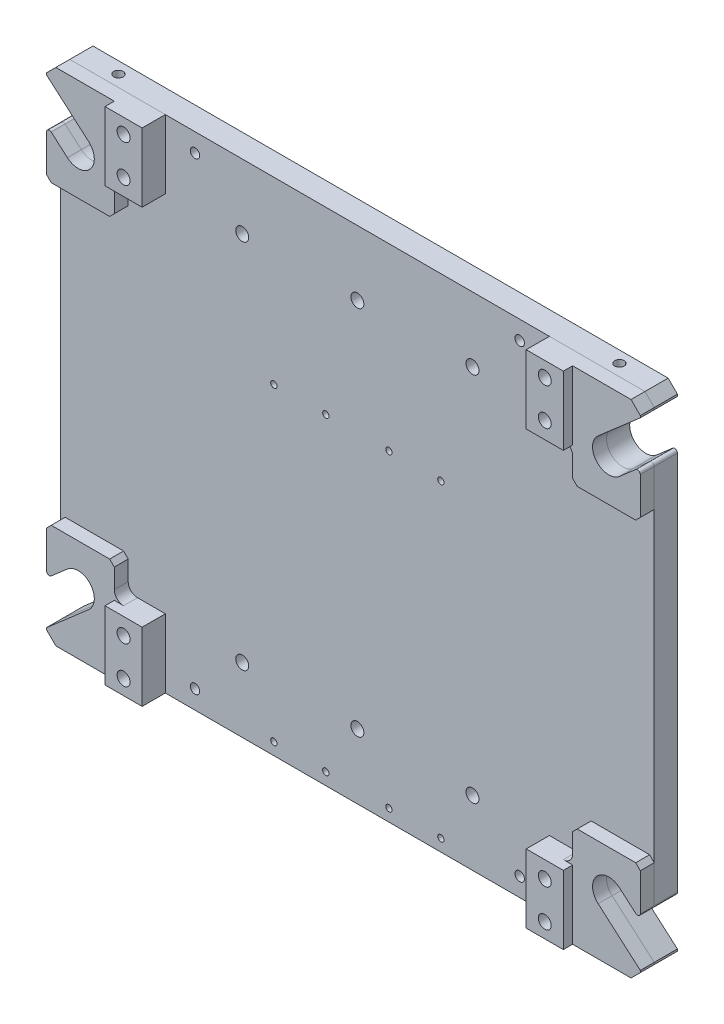
from build123d import *

# Parameters (mm, degrees)
ESBO_O1_W                                    = 300
ESBO_O1_H                                    = 600
RESSALTO_EXTRUS_O1_DEPTH                     = 25
ESBO_O2_W                                    = 25
ESBO_O2_H                                    = 600
RESSALTO_EXTRUS_O2_DEPTH                     = 170
CHANFRO1_SIZE                                = 10
MOVER_START                                  = -240
MOVER_FACE1_DEPTH                            = 25
MOVER_FACE2_DEPTH                            = 25
MOVER_FACE4_DEPTH                            = 25
MOVER_FACE5_DEPTH                            = 25
CORTE_EXTRUS_O1_DEPTH                        = 420.434142626
ESBO_O4_W                                    = 40
ESBO_O4_H                                    = 74
NNN_DEPTH                                    = 15
NNN_2_DEPTH                                  = 15
NNN_3_DEPTH                                  = 15
NNN_4_DEPTH                                  = 15
NNN_5_DEPTH                                  = 15
NNN_6_DEPTH                                  = 15
NNN_7_DEPTH                                  = 15
NNN_8_DEPTH                                  = 15
MOVER_FACE3_BY                               = 10
MOVER_FACE3_2_BY                             = 10
MOVER_FACE3_3_BY                             = 10
MOVER_FACE3_4_BY                             = 10
RESSALTO_EXTRUS_O9_DEPTH                     = 15
CORTE_EXTRUS_O3_DEPTH                        = 422.663372846
CORTE_EXTRUS_O4_DEPTH                        = 421.594816896
MOVER_START_2                                = -215
MOVER_FACE6_DEPTH                            = 15
MOVER_FACE7_DEPTH                            = 15
MOVER_FACE8_DEPTH                            = 15
MOVER_FACE9_DEPTH                            = 15
FURO_ROSCADO_DE_M81_AT_2_COUNT               = 2
FURO_ROSCADO_DE_M81_AT_2_PITCH               = 56
FURO_ROSCADO_DE_M81_AT_3_COUNT               = 2
FURO_ROSCADO_DE_M81_AT_3_PITCH               = 124
FURO_ROSCADO_DE_M81_AT_4_COUNT               = 2
FURO_ROSCADO_DE_M81_AT_4_PITCH               = 180
FURO_ROSCADO_DE_M81_AT_5_COUNT               = 2
FURO_ROSCADO_DE_M81_AT_5_PITCH               = 333.5
FURO_ROSCADO_DE_M81_AT_6_COUNT               = 2
FURO_ROSCADO_DE_M81_AT_6_PITCH               = 338.168966642
FURO_ROSCADO_DE_M81_AT_7_COUNT               = 2
FURO_ROSCADO_DE_M81_AT_7_PITCH               = 355.8064783
FURO_ROSCADO_DE_M81_AT_8_COUNT               = 2
FURO_ROSCADO_DE_M81_AT_8_PITCH               = 378.975263045
REBAIXO_PARA_PARAFUSO_ALLEN_SEXTAVAD_2_COUNT = 2
REBAIXO_PARA_PARAFUSO_ALLEN_SEXTAVAD_2_PITCH = 400
REBAIXO_PARA_PARAFUSO_ALLEN_SEXTAVAD_3_COUNT = 2
REBAIXO_PARA_PARAFUSO_ALLEN_SEXTAVAD_3_PITCH = 418.808798857
REBAIXO_PARA_PARAFUSO_ALLEN_SEXTAVAD_4_COUNT = 2
REBAIXO_PARA_PARAFUSO_ALLEN_SEXTAVAD_4_PITCH = 470.747533185
REBAIXO_PARA_PARAFUSO_ALLEN_SEXTAVAD_5_COUNT = 2
REBAIXO_PARA_PARAFUSO_ALLEN_SEXTAVAD_5_PITCH = 248.2
REBAIXO_PARA_PARAFUSO_ALLEN_SEXTAVAD_6_COUNT = 2
REBAIXO_PARA_PARAFUSO_ALLEN_SEXTAVAD_6_PITCH = 124.1
FURO_ROSCADO_DE_M161_AT_2_COUNT              = 2
FURO_ROSCADO_DE_M161_AT_2_PITCH              = 40
FURO_ROSCADO_DE_M161_AT_3_COUNT              = 2
FURO_ROSCADO_DE_M161_AT_3_PITCH              = 454
FURO_ROSCADO_DE_M161_AT_4_COUNT              = 2
FURO_ROSCADO_DE_M161_AT_4_PITCH              = 455.75870809
FURO_ROSCADO_DE_M161_AT_5_COUNT              = 2
FURO_ROSCADO_DE_M161_AT_5_PITCH              = 652.027606778
FURO_ROSCADO_DE_M161_AT_6_COUNT              = 2
FURO_ROSCADO_DE_M161_AT_6_PITCH              = 681.307566375
FURO_ROSCADO_DE_M161_AT_7_COUNT              = 2
FURO_ROSCADO_DE_M161_AT_7_PITCH              = 508
FURO_ROSCADO_DE_M161_AT_8_COUNT              = 2
FURO_ROSCADO_DE_M161_AT_8_PITCH              = 468
FILETE1_R                                    = 3
FILETE2_R                                    = 3
FILETE3_R                                    = 3
FILETE4_R                                    = 3
FILETE5_R                                    = 3
FURO_ROSCADO_DE_M121_AT_2_COUNT              = 2
FURO_ROSCADO_DE_M121_AT_2_PITCH              = 540
FURO_ROSCADO_DE_M1211_AT_2_COUNT             = 2
FURO_ROSCADO_DE_M1211_AT_2_PITCH             = 500
FURO_ROSCADO_DE_M1211_AT_3_COUNT             = 2
FURO_ROSCADO_DE_M1211_AT_3_PITCH             = 350
FURO_ROSCADO_DE_M1211_AT_4_COUNT             = 2
FURO_ROSCADO_DE_M1211_AT_4_PITCH             = 610.327780787
FILETE9_R                                    = 10
FILETE8_R                                    = 10
FILETE7_R                                    = 10
FILETE6_R                                    = 10
EXCLUIR_START                                = -240
EXCLUIR_FACE1_DEPTH                          = 25
CORTE_EXTRUS_O5_DEPTH                        = 421.594816896
RESSALTO_EXTRUS_O11_DEPTH                    = 15


# Read off the part's stored shape, not the designer's step: Mover face1, Mover face2, Mover face4, Mover face5, Mover face6, Mover face7, Mover face8, Mover face9, Excluir face1
with BuildPart() as part:
    # Esboço1 → Ressalto-extrusão1 (new body)
    with BuildSketch(Plane.XY.offset(-240)):
        Rectangle(ESBO_O1_W, ESBO_O1_H)
    extrude(amount=RESSALTO_EXTRUS_O1_DEPTH)

    # Esboço2 → Ressalto-extrusão2 (add)
    with BuildSketch(Plane(origin=(150, 0, 0), x_dir=(0, 0, -1), z_dir=(1, 0, 0))):
        with Locations((227.5, 0)):
            Rectangle(ESBO_O2_W, ESBO_O2_H)
    ressalto_extrus_o2 = extrude(amount=RESSALTO_EXTRUS_O2_DEPTH)

    # Espelhar1: Ressalto-extrusão2 across plane
    add(ressalto_extrus_o2.mirror(Plane(origin=(0, 0, 0), x_dir=(0, 0, 1), z_dir=(1, 0, 0))))

    # Chanfro1
    chanfro1_edges = [part.edges().sort_by_distance(p)[0] for p in [
        (320, 300, -227.5),
        (320, -300, -227.5),
        (-320, 300, -227.5),
        (-320, -300, -227.5),
    ]]
    chamfer(chanfro1_edges, length=CHANFRO1_SIZE)

    # Mover face1 outline → Mover face1 (add)
    with BuildSketch(Plane.XY.offset(MOVER_START)):
        Polygon((-310, -330), (310, -330), (320, -320), (320, -290), (310, -300), (-310, -300), (-320, -290), (-320, -320), align=None)
    extrude(amount=MOVER_FACE1_DEPTH)

    # Mover face2 outline → Mover face2 (add)
    with BuildSketch(Plane.XY.offset(MOVER_START)):
        Polygon((310, 330), (-310, 330), (-320, 320), (-320, 290), (-310, 300), (310, 300), (320, 290), (320, 320), align=None)
    extrude(amount=MOVER_FACE2_DEPTH)

    # Mover face4 outline → Mover face4 (cut)
    with BuildSketch(Plane.XY.offset(MOVER_START)):
        Polygon((320, -260), (310, -270), (-310, -270), (-320, -260), (-320, -320), (-310, -330), (310, -330), (320, -320), align=None)
    extrude(amount=MOVER_FACE4_DEPTH, mode=Mode.SUBTRACT)

    # Mover face5 outline → Mover face5 (cut)
    with BuildSketch(Plane.XY.offset(MOVER_START)):
        Polygon((-320, 260), (-310, 270), (310, 270), (320, 260), (320, 320), (310, 330), (-310, 330), (-320, 320), align=None)
    extrude(amount=MOVER_FACE5_DEPTH, mode=Mode.SUBTRACT)

    # Esboço3 → Corte-extrusão1 (cut, through all)
    with BuildSketch(Plane.XY.offset(-215)):
        with BuildLine():
            Line((-355, -134.9), (-285, -134.9))
            ThreePointArc((-285, -134.9), (-267.5, -152.4), (-285, -169.9))
            Line((-285, -169.9), (-355, -169.9))
            ThreePointArc((-355, -169.9), (-372.5, -152.4), (-355, -134.9))
        make_face()
        with BuildLine():
            Line((-355, 134.9), (-285, 134.9))
            ThreePointArc((-285, 134.9), (-267.5, 152.4), (-285, 169.9))
            Line((-285, 169.9), (-355, 169.9))
            ThreePointArc((-355, 169.9), (-372.5, 152.4), (-355, 134.9))
        make_face()
        with BuildLine():
            Line((355, 134.9), (285, 134.9))
            ThreePointArc((285, 134.9), (267.5, 152.4), (285, 169.9))
            Line((285, 169.9), (355, 169.9))
            ThreePointArc((355, 169.9), (372.5, 152.4), (355, 134.9))
        make_face()
        with BuildLine():
            Line((355, -134.9), (285, -134.9))
            ThreePointArc((285, -134.9), (267.5, -152.4), (285, -169.9))
            Line((285, -169.9), (355, -169.9))
            ThreePointArc((355, -169.9), (372.5, -152.4), (355, -134.9))
        make_face()
    extrude(amount=-CORTE_EXTRUS_O1_DEPTH, mode=Mode.SUBTRACT)


with BuildPart() as body_2:
    # Esboço4 → nnn (new body)
    with BuildSketch(Plane.XY.offset(-215)):
        with Locations((227, -233)):
            Rectangle(ESBO_O4_W, ESBO_O4_H)
    extrude(amount=NNN_DEPTH)

    # Mover face3 3: a face moved outward by 10.0
    extrude(body_2.faces().sort_by_distance((227, -233, -200))[0], amount=MOVER_FACE3_3_BY, dir=(0, 0, 1))


with BuildPart() as body_3:
    # Esboço4 → nnn 2 (new body)
    with BuildSketch(Plane.XY.offset(-215)):
        with Locations((227, 233)):
            Rectangle(ESBO_O4_W, ESBO_O4_H)
    extrude(amount=NNN_2_DEPTH)

    # Mover face3: a face moved outward by 10.0
    extrude(body_3.faces().sort_by_distance((227, 233, -200))[0], amount=MOVER_FACE3_BY, dir=(0, 0, 1))


with BuildPart() as body_4:
    # Esboço4 → nnn 3 (new body)
    with BuildSketch(Plane.XY.offset(-215)):
        with Locations((-227, 233)):
            Rectangle(ESBO_O4_W, ESBO_O4_H)
    extrude(amount=NNN_3_DEPTH)

    # Mover face3 2: a face moved outward by 10.0
    extrude(body_4.faces().sort_by_distance((-227, 233, -200))[0], amount=MOVER_FACE3_2_BY, dir=(0, 0, 1))


with BuildPart() as body_5:
    # Esboço4 → nnn 4 (new body)
    with BuildSketch(Plane.XY.offset(-215)):
        with Locations((-227, -233)):
            Rectangle(ESBO_O4_W, ESBO_O4_H)
    extrude(amount=NNN_4_DEPTH)

    # Mover face3 4: a face moved outward by 10.0
    extrude(body_5.faces().sort_by_distance((-227, -233, -200))[0], amount=MOVER_FACE3_4_BY, dir=(0, 0, 1))


with BuildPart() as body_6:
    # Esboço4 → nnn 5 (new body)
    with BuildSketch(Plane.XY.offset(-215)):
        with BuildLine():
            Line((320, 169.9), (320, 184.9))
            Line((320, 184.9), (315, 189.9))
            Line((315, 189.9), (257, 189.9))
            Line((257, 189.9), (247, 179.9))
            Line((247, 179.9), (247, 124.9))
            Line((247, 124.9), (257, 114.9))
            Line((257, 114.9), (315, 114.9))
            Line((315, 114.9), (320, 119.9))
            Line((320, 119.9), (320, 134.9))
            Line((320, 134.9), (285, 134.9))
            ThreePointArc((285, 134.9), (267.5, 152.4), (285, 169.9))
            Line((285, 169.9), (320, 169.9))
        make_face()
    extrude(amount=NNN_5_DEPTH)


with BuildPart() as body_7:
    # Esboço4 → nnn 6 (new body)
    with BuildSketch(Plane.XY.offset(-215)):
        with BuildLine():
            Line((-320, -169.9), (-320, -184.9))
            Line((-320, -184.9), (-315, -189.9))
            Line((-315, -189.9), (-257, -189.9))
            Line((-257, -189.9), (-247, -179.9))
            Line((-247, -179.9), (-247, -124.9))
            Line((-247, -124.9), (-257, -114.9))
            Line((-257, -114.9), (-315, -114.9))
            Line((-315, -114.9), (-320, -119.9))
            Line((-320, -119.9), (-320, -134.9))
            Line((-320, -134.9), (-285, -134.9))
            ThreePointArc((-285, -134.9), (-267.5, -152.4), (-285, -169.9))
            Line((-285, -169.9), (-320, -169.9))
        make_face()
    extrude(amount=NNN_6_DEPTH)


    add(body_5.part)  # Ressalto-extrusão9 merges body 5

    add(body_4.part)  # Ressalto-extrusão9 merges body 4


with BuildPart() as body_8:
    # Esboço4 → nnn 7 (new body)
    with BuildSketch(Plane.XY.offset(-215)):
        with BuildLine():
            Line((320, -134.9), (320, -119.9))
            Line((320, -119.9), (315, -114.9))
            Line((315, -114.9), (257, -114.9))
            Line((257, -114.9), (247, -124.9))
            Line((247, -124.9), (247, -179.9))
            Line((247, -179.9), (257, -189.9))
            Line((257, -189.9), (315, -189.9))
            Line((315, -189.9), (320, -184.9))
            Line((320, -184.9), (320, -169.9))
            Line((320, -169.9), (285, -169.9))
            ThreePointArc((285, -169.9), (267.5, -152.4), (285, -134.9))
            Line((285, -134.9), (320, -134.9))
        make_face()
    extrude(amount=NNN_7_DEPTH)


with BuildPart() as body_9:
    # Esboço4 → nnn 8 (new body)
    with BuildSketch(Plane.XY.offset(-215)):
        with BuildLine():
            Line((-320, 134.9), (-320, 119.9))
            Line((-320, 119.9), (-315, 114.9))
            Line((-315, 114.9), (-257, 114.9))
            Line((-257, 114.9), (-247, 124.9))
            Line((-247, 124.9), (-247, 179.9))
            Line((-247, 179.9), (-257, 189.9))
            Line((-257, 189.9), (-315, 189.9))
            Line((-315, 189.9), (-320, 184.9))
            Line((-320, 184.9), (-320, 169.9))
            Line((-320, 169.9), (-285, 169.9))
            ThreePointArc((-285, 169.9), (-267.5, 152.4), (-285, 134.9))
            Line((-285, 134.9), (-320, 134.9))
        make_face()
    extrude(amount=NNN_8_DEPTH)


with BuildPart() as body_7_1:
    add(body_7.part)

    add(body_9.part)  # Ressalto-extrusão9 merges body 9

    add(body_3.part)  # Ressalto-extrusão9 merges body 3

    add(body_6.part)  # Ressalto-extrusão9 merges body 6

    add(body_8.part)  # Ressalto-extrusão9 merges body 8

    add(body_2.part)  # Ressalto-extrusão9 merges body 2
    # Esboço48 → Ressalto-extrusão9 (add)
    with BuildSketch(Plane.XY.offset(-200)):
        Polygon((-320, 260), (-320, 177.4), (-247, 177.4), (-247, 270), (-310, 270), align=None)
        Polygon((320, 260), (310, 270), (247, 270), (247, 177.4), (320, 177.4), align=None)
        Polygon((310, -270), (320, -260), (320, -177.4), (247, -177.4), (247, -270), align=None)
        Polygon((-320, -260), (-310, -270), (-247, -270), (-247, -177.4), (-320, -177.4), align=None)
    extrude(amount=-RESSALTO_EXTRUS_O9_DEPTH)


with BuildPart() as corte_extrus_o3_tool:
    # Esboço51 → Corte-extrusão3 (new, through all)
    with BuildSketch(Plane.XY.offset(-190)):
        Polygon((-320, -169.9), (-320, -174.9), (-315, -169.9), align=None)
        Polygon((-320, -129.9), (-315, -134.9), (-320, -134.9), align=None)
        Polygon((-320, 174.9), (-315, 169.9), (-320, 169.9), align=None)
        Polygon((-320, 134.9), (-320, 129.9), (-315, 134.9), align=None)
        Polygon((315, -134.9), (320, -134.9), (320, -129.9), align=None)
        Polygon((315, -169.9), (320, -169.9), (320, -174.9), align=None)
        Polygon((320, 129.9), (315, 134.9), (320, 134.9), align=None)
        Polygon((315, 169.9), (320, 169.9), (320, 174.9), align=None)
    extrude(amount=-CORTE_EXTRUS_O3_DEPTH)


with BuildPart() as part_1:
    add(part.part)

    # Corte-extrusão3: cut by corte_extrus_o3_tool
    add(corte_extrus_o3_tool.part, mode=Mode.SUBTRACT)


with BuildPart() as body_7_2:
    add(body_7_1.part)

    # Corte-extrusão3: cut by corte_extrus_o3_tool
    add(corte_extrus_o3_tool.part, mode=Mode.SUBTRACT)


with BuildPart() as corte_extrus_o4_tool:
    # Esboço53 → Corte-extrusão4 (new, through all)
    with BuildSketch(Plane.XY.offset(-200)):
        with BuildLine():
            Line((-274.557035883, -218.39218056), (-342.480898103, -277.437493169))
            ThreePointArc((-342.480898103, -277.437493169), (-367.169348764, -275.711108522), (-365.442964117, -251.022657861))
            Line((-365.442964117, -251.022657861), (-297.519101897, -191.977345252))
            ThreePointArc((-297.519101897, -191.977345252), (-272.830651236, -193.703729898), (-274.557035883, -218.39218056))
        make_face()
        with BuildLine():
            Line((-274.557035883, 218.39218056), (-342.480898103, 277.437493169))
            ThreePointArc((-342.480898103, 277.437493169), (-367.169348764, 275.711108522), (-365.442964117, 251.022657861))
            Line((-365.442964117, 251.022657861), (-297.519101897, 191.977345252))
            ThreePointArc((-297.519101897, 191.977345252), (-272.830651236, 193.703729898), (-274.557035883, 218.39218056))
        make_face()
        with BuildLine():
            Line((274.557035883, 218.39218056), (342.480898103, 277.437493169))
            ThreePointArc((342.480898103, 277.437493169), (367.169348764, 275.711108522), (365.442964117, 251.022657861))
            Line((365.442964117, 251.022657861), (297.519101897, 191.977345252))
            ThreePointArc((297.519101897, 191.977345252), (272.830651236, 193.703729898), (274.557035883, 218.39218056))
        make_face()
        with BuildLine():
            Line((274.557035883, -218.39218056), (342.480898103, -277.437493169))
            ThreePointArc((342.480898103, -277.437493169), (367.169348764, -275.711108522), (365.442964117, -251.022657861))
            Line((365.442964117, -251.022657861), (297.519101897, -191.977345252))
            ThreePointArc((297.519101897, -191.977345252), (272.830651236, -193.703729898), (274.557035883, -218.39218056))
        make_face()
    extrude(amount=-CORTE_EXTRUS_O4_DEPTH)


with BuildPart() as part_2:
    add(part_1.part)

    # Corte-extrusão4: cut by corte_extrus_o4_tool
    add(corte_extrus_o4_tool.part, mode=Mode.SUBTRACT)

    # Esboço41 → Furo roscado de M81 (revolve, cut)
    with BuildSketch(Plane(origin=(-90, 76.5, -215), x_dir=(0, -1, 0), z_dir=(1, 0, 0))):
        Polygon((0, 0), (0, 20.042926105), (3.4, 18), (3.4, 0), align=None)
    furo_roscado_de_m81 = revolve(axis=Axis((-90, 76.5, -208.65), (0, 0, -1)), mode=Mode.SUBTRACT)

    # Furo roscado de M81 at 2: Furo roscado de M81 ×2
    with Locations(*[(i * FURO_ROSCADO_DE_M81_AT_2_PITCH, 0, 0) for i in range(1, FURO_ROSCADO_DE_M81_AT_2_COUNT)]):
        add(furo_roscado_de_m81, mode=Mode.SUBTRACT)

    # Furo roscado de M81 at 3: Furo roscado de M81 ×2
    with Locations(*[(i * FURO_ROSCADO_DE_M81_AT_3_PITCH, 0, 0) for i in range(1, FURO_ROSCADO_DE_M81_AT_3_COUNT)]):
        add(furo_roscado_de_m81, mode=Mode.SUBTRACT)

    # Furo roscado de M81 at 4: Furo roscado de M81 ×2
    with Locations(*[(i * FURO_ROSCADO_DE_M81_AT_4_PITCH, 0, 0) for i in range(1, FURO_ROSCADO_DE_M81_AT_4_COUNT)]):
        add(furo_roscado_de_m81, mode=Mode.SUBTRACT)

    # Furo roscado de M81 at 5: Furo roscado de M81 ×2
    with Locations(*[(0, -i * FURO_ROSCADO_DE_M81_AT_5_PITCH, 0) for i in range(1, FURO_ROSCADO_DE_M81_AT_5_COUNT)]):
        add(furo_roscado_de_m81, mode=Mode.SUBTRACT)

    # Furo roscado de M81 at 6: Furo roscado de M81 ×2
    with Locations(*[Vector(0.16559769087035991, -0.9861933911654472, 0) * (i * FURO_ROSCADO_DE_M81_AT_6_PITCH) for i in range(1, FURO_ROSCADO_DE_M81_AT_6_COUNT)]):
        add(furo_roscado_de_m81, mode=Mode.SUBTRACT)

    # Furo roscado de M81 at 7: Furo roscado de M81 ×2
    with Locations(*[Vector(0.3485040536433699, -0.937307273306966, 0) * (i * FURO_ROSCADO_DE_M81_AT_7_PITCH) for i in range(1, FURO_ROSCADO_DE_M81_AT_7_COUNT)]):
        add(furo_roscado_de_m81, mode=Mode.SUBTRACT)

    # Furo roscado de M81 at 8: Furo roscado de M81 ×2
    with Locations(*[Vector(0.4749650374374, -0.8800046665854047, 0) * (i * FURO_ROSCADO_DE_M81_AT_8_PITCH) for i in range(1, FURO_ROSCADO_DE_M81_AT_8_COUNT)]):
        add(furo_roscado_de_m81, mode=Mode.SUBTRACT)

    # Esboço8 → Rebaixo para parafuso Allen sextavado de M121 (revolve, cut)
    with BuildSketch(Plane(origin=(-124.1, -200, -240), x_dir=(0, 1, 0), z_dir=(1, 0, 0))):
        Polygon((0, 0), (0, 25), (7, 25), (7, 13), (10, 13), (10, 0), align=None)
    rebaixo_para_parafuso_allen_sextavado_de = revolve(axis=Axis((-124.1, -200, -246.35), (0, 0, 1)), mode=Mode.SUBTRACT)

    # Rebaixo para parafuso Allen sextavad 2: Rebaixo para parafuso Allen sextavado de M121 ×2
    with Locations(*[(0, i * REBAIXO_PARA_PARAFUSO_ALLEN_SEXTAVAD_2_PITCH, 0) for i in range(1, REBAIXO_PARA_PARAFUSO_ALLEN_SEXTAVAD_2_COUNT)]):
        add(rebaixo_para_parafuso_allen_sextavado_de, mode=Mode.SUBTRACT)

    # Rebaixo para parafuso Allen sextavad 3: Rebaixo para parafuso Allen sextavado de M121 ×2
    with Locations(*[Vector(0.2963166016060431, 0.9550897714940966, 0) * (i * REBAIXO_PARA_PARAFUSO_ALLEN_SEXTAVAD_3_PITCH) for i in range(1, REBAIXO_PARA_PARAFUSO_ALLEN_SEXTAVAD_3_COUNT)]):
        add(rebaixo_para_parafuso_allen_sextavado_de, mode=Mode.SUBTRACT)

    # Rebaixo para parafuso Allen sextavad 4: Rebaixo para parafuso Allen sextavado de M121 ×2
    with Locations(*[Vector(0.5272465228242129, 0.8497123655507061, 0) * (i * REBAIXO_PARA_PARAFUSO_ALLEN_SEXTAVAD_4_PITCH) for i in range(1, REBAIXO_PARA_PARAFUSO_ALLEN_SEXTAVAD_4_COUNT)]):
        add(rebaixo_para_parafuso_allen_sextavado_de, mode=Mode.SUBTRACT)

    # Rebaixo para parafuso Allen sextavad 5: Rebaixo para parafuso Allen sextavado de M121 ×2
    with Locations(*[(i * REBAIXO_PARA_PARAFUSO_ALLEN_SEXTAVAD_5_PITCH, 0, 0) for i in range(1, REBAIXO_PARA_PARAFUSO_ALLEN_SEXTAVAD_5_COUNT)]):
        add(rebaixo_para_parafuso_allen_sextavado_de, mode=Mode.SUBTRACT)

    # Rebaixo para parafuso Allen sextavad 6: Rebaixo para parafuso Allen sextavado de M121 ×2
    with Locations(*[(i * REBAIXO_PARA_PARAFUSO_ALLEN_SEXTAVAD_6_PITCH, 0, 0) for i in range(1, REBAIXO_PARA_PARAFUSO_ALLEN_SEXTAVAD_6_COUNT)]):
        add(rebaixo_para_parafuso_allen_sextavado_de, mode=Mode.SUBTRACT)


with BuildPart() as body_7_3:
    add(body_7_2.part)

    # Corte-extrusão4: cut by corte_extrus_o4_tool
    add(corte_extrus_o4_tool.part, mode=Mode.SUBTRACT)

    # Mover face6 outline → Mover face6 (add)
    with BuildSketch(Plane.XY.offset(MOVER_START_2)):
        Polygon((-320, -109.9), (-320, -119.9), (-315, -114.9), (-257, -114.9), (-247, -124.9), (-247, -114.9), (-257, -104.9), (-315, -104.9), align=None)
    extrude(amount=MOVER_FACE6_DEPTH)

    # Mover face7 outline → Mover face7 (add)
    with BuildSketch(Plane.XY.offset(MOVER_START_2)):
        Polygon((-320, 119.9), (-320, 109.9), (-315, 104.9), (-257, 104.9), (-247, 114.9), (-247, 124.9), (-257, 114.9), (-315, 114.9), align=None)
    extrude(amount=MOVER_FACE7_DEPTH)

    # Mover face8 outline → Mover face8 (add)
    with BuildSketch(Plane.XY.offset(MOVER_START_2)):
        Polygon((320, -119.9), (320, -109.9), (315, -104.9), (257, -104.9), (247, -114.9), (247, -124.9), (257, -114.9), (315, -114.9), align=None)
    extrude(amount=MOVER_FACE8_DEPTH)

    # Mover face9 outline → Mover face9 (add)
    with BuildSketch(Plane.XY.offset(MOVER_START_2)):
        Polygon((320, 109.9), (320, 119.9), (315, 114.9), (257, 114.9), (247, 124.9), (247, 114.9), (257, 104.9), (315, 104.9), align=None)
    extrude(amount=MOVER_FACE9_DEPTH)


with BuildPart() as furo_roscado_de_m161_tool:
    # Esboço42 → Furo roscado de M161 (revolve)
    with BuildSketch(Plane(origin=(227, -254, -190), x_dir=(0, -1, 0), z_dir=(1, 0, 0))):
        Polygon((0, 0), (0, 34.206024333), (7, 30), (7, 0), align=None)
    furo_roscado_de_m161 = revolve(axis=Axis((227, -254, -183.65), (0, 0, -1)))


with BuildPart() as part_3:
    add(part_2.part)

    # Furo roscado de M161: cut by furo_roscado_de_m161_tool
    add(furo_roscado_de_m161_tool.part, mode=Mode.SUBTRACT)


with BuildPart() as body_7_4:
    add(body_7_3.part)

    # Furo roscado de M161: cut by furo_roscado_de_m161_tool
    add(furo_roscado_de_m161_tool.part, mode=Mode.SUBTRACT)


with BuildPart() as furo_roscado_de_m161_at_2_tool:
    # Furo roscado de M161 at 2: Furo roscado de M161 ×2
    with Locations(*[(0, i * FURO_ROSCADO_DE_M161_AT_2_PITCH, 0) for i in range(1, FURO_ROSCADO_DE_M161_AT_2_COUNT)]):
        add(furo_roscado_de_m161)


with BuildPart() as part_4:
    add(part_3.part)

    # Furo roscado de M161 at 2: cut by furo_roscado_de_m161_at_2_tool
    add(furo_roscado_de_m161_at_2_tool.part, mode=Mode.SUBTRACT)


with BuildPart() as body_7_5:
    add(body_7_4.part)

    # Furo roscado de M161 at 2: cut by furo_roscado_de_m161_at_2_tool
    add(furo_roscado_de_m161_at_2_tool.part, mode=Mode.SUBTRACT)


with BuildPart() as furo_roscado_de_m161_at_3_tool:
    # Furo roscado de M161 at 3: Furo roscado de M161 ×2
    with Locations(*[(-i * FURO_ROSCADO_DE_M161_AT_3_PITCH, 0, 0) for i in range(1, FURO_ROSCADO_DE_M161_AT_3_COUNT)]):
        add(furo_roscado_de_m161)


with BuildPart() as part_5:
    add(part_4.part)

    # Furo roscado de M161 at 3: cut by furo_roscado_de_m161_at_3_tool
    add(furo_roscado_de_m161_at_3_tool.part, mode=Mode.SUBTRACT)


with BuildPart() as body_7_6:
    add(body_7_5.part)

    # Furo roscado de M161 at 3: cut by furo_roscado_de_m161_at_3_tool
    add(furo_roscado_de_m161_at_3_tool.part, mode=Mode.SUBTRACT)


with BuildPart() as furo_roscado_de_m161_at_4_tool:
    # Furo roscado de M161 at 4: Furo roscado de M161 ×2
    with Locations(*[Vector(-0.9961411421023264, 0.08776573939227543, 0) * (i * FURO_ROSCADO_DE_M161_AT_4_PITCH) for i in range(1, FURO_ROSCADO_DE_M161_AT_4_COUNT)]):
        add(furo_roscado_de_m161)


with BuildPart() as part_6:
    add(part_5.part)

    # Furo roscado de M161 at 4: cut by furo_roscado_de_m161_at_4_tool
    add(furo_roscado_de_m161_at_4_tool.part, mode=Mode.SUBTRACT)


with BuildPart() as body_7_7:
    add(body_7_6.part)

    # Furo roscado de M161 at 4: cut by furo_roscado_de_m161_at_4_tool
    add(furo_roscado_de_m161_at_4_tool.part, mode=Mode.SUBTRACT)


with BuildPart() as furo_roscado_de_m161_at_5_tool:
    # Furo roscado de M161 at 5: Furo roscado de M161 ×2
    with Locations(*[Vector(-0.6962895363338835, 0.7177610198331654, 0) * (i * FURO_ROSCADO_DE_M161_AT_5_PITCH) for i in range(1, FURO_ROSCADO_DE_M161_AT_5_COUNT)]):
        add(furo_roscado_de_m161)


with BuildPart() as part_7:
    add(part_6.part)

    # Furo roscado de M161 at 5: cut by furo_roscado_de_m161_at_5_tool
    add(furo_roscado_de_m161_at_5_tool.part, mode=Mode.SUBTRACT)


with BuildPart() as body_7_8:
    add(body_7_7.part)

    # Furo roscado de M161 at 5: cut by furo_roscado_de_m161_at_5_tool
    add(furo_roscado_de_m161_at_5_tool.part, mode=Mode.SUBTRACT)


with BuildPart() as furo_roscado_de_m161_at_6_tool:
    # Furo roscado de M161 at 6: Furo roscado de M161 ×2
    with Locations(*[Vector(-0.6663657097124144, 0.7456250672552999, 0) * (i * FURO_ROSCADO_DE_M161_AT_6_PITCH) for i in range(1, FURO_ROSCADO_DE_M161_AT_6_COUNT)]):
        add(furo_roscado_de_m161)


with BuildPart() as part_8:
    add(part_7.part)

    # Furo roscado de M161 at 6: cut by furo_roscado_de_m161_at_6_tool
    add(furo_roscado_de_m161_at_6_tool.part, mode=Mode.SUBTRACT)


with BuildPart() as body_7_9:
    add(body_7_8.part)

    # Furo roscado de M161 at 6: cut by furo_roscado_de_m161_at_6_tool
    add(furo_roscado_de_m161_at_6_tool.part, mode=Mode.SUBTRACT)


with BuildPart() as furo_roscado_de_m161_at_7_tool:
    # Furo roscado de M161 at 7: Furo roscado de M161 ×2
    with Locations(*[(0, i * FURO_ROSCADO_DE_M161_AT_7_PITCH, 0) for i in range(1, FURO_ROSCADO_DE_M161_AT_7_COUNT)]):
        add(furo_roscado_de_m161)


with BuildPart() as part_9:
    add(part_8.part)

    # Furo roscado de M161 at 7: cut by furo_roscado_de_m161_at_7_tool
    add(furo_roscado_de_m161_at_7_tool.part, mode=Mode.SUBTRACT)


with BuildPart() as body_7_10:
    add(body_7_9.part)

    # Furo roscado de M161 at 7: cut by furo_roscado_de_m161_at_7_tool
    add(furo_roscado_de_m161_at_7_tool.part, mode=Mode.SUBTRACT)


with BuildPart() as furo_roscado_de_m161_at_8_tool:
    # Furo roscado de M161 at 8: Furo roscado de M161 ×2
    with Locations(*[(0, i * FURO_ROSCADO_DE_M161_AT_8_PITCH, 0) for i in range(1, FURO_ROSCADO_DE_M161_AT_8_COUNT)]):
        add(furo_roscado_de_m161)


with BuildPart() as part_10:
    add(part_9.part)

    # Furo roscado de M161 at 8: cut by furo_roscado_de_m161_at_8_tool
    add(furo_roscado_de_m161_at_8_tool.part, mode=Mode.SUBTRACT)

    # Filete1
    filete1_edges = [part_10.edges().sort_by_distance(p)[0] for p in [
        (-320, -211.519691827, -227.5),
        (320, 211.519691827, -227.5),
        (-320, 211.519691827, -227.5),
        (320, -211.519691827, -227.5),
    ]]
    fillet(filete1_edges, radius=FILETE1_R)

    # Esboço49 → Furo roscado de M121 (revolve, cut)
    with BuildSketch(Plane(origin=(-270, -270, -227.5), x_dir=(0, 0, -1), z_dir=(1, 0, 0))):
        Polygon((0, 0), (0, 38.064389157), (5.1, 35), (5.1, 0), align=None)
    furo_roscado_de_m121 = revolve(axis=Axis((-270, -276.35, -227.5), (0, 1, 0)), mode=Mode.SUBTRACT)

    # Furo roscado de M121 at 2: Furo roscado de M121 ×2
    with Locations(*[(i * FURO_ROSCADO_DE_M121_AT_2_PITCH, 0, 0) for i in range(1, FURO_ROSCADO_DE_M121_AT_2_COUNT)]):
        add(furo_roscado_de_m121, mode=Mode.SUBTRACT)

    # Espelhar2: Furo roscado de M121 across Top Plane
    add(furo_roscado_de_m121.mirror(Plane(origin=(0, 0, 0), x_dir=(1, 0, 0), z_dir=(0, 1, 0))), mode=Mode.SUBTRACT)

    # Espelhar2 copy 1 sketch → Espelhar2 copy 1 (revolve, cut)
    with BuildSketch(Plane(origin=(270, 270, -227.5), x_dir=(0, 0, -1), z_dir=(1, 0, 0))):
        Polygon((0, 0), (0, -38.064389157), (5.1, -35), (5.1, 0), align=None)
    revolve(axis=Axis((270, 276.35, -227.5), (0, 1, 0)), mode=Mode.SUBTRACT)

    # Esboço410 → Furo roscado de M1211 (revolve, cut)
    with BuildSketch(Plane(origin=(175, -250, -215), x_dir=(0, -1, 0), z_dir=(1, 0, 0))):
        Polygon((0, 0), (0, 38.064389157), (5.1, 35), (5.1, 0), align=None)
    furo_roscado_de_m1211 = revolve(axis=Axis((175, -250, -208.65), (0, 0, -1)), mode=Mode.SUBTRACT)

    # Furo roscado de M1211 at 2: Furo roscado de M1211 ×2
    with Locations(*[(0, i * FURO_ROSCADO_DE_M1211_AT_2_PITCH, 0) for i in range(1, FURO_ROSCADO_DE_M1211_AT_2_COUNT)]):
        add(furo_roscado_de_m1211, mode=Mode.SUBTRACT)

    # Furo roscado de M1211 at 3: Furo roscado de M1211 ×2
    with Locations(*[(-i * FURO_ROSCADO_DE_M1211_AT_3_PITCH, 0, 0) for i in range(1, FURO_ROSCADO_DE_M1211_AT_3_COUNT)]):
        add(furo_roscado_de_m1211, mode=Mode.SUBTRACT)

    # Furo roscado de M1211 at 4: Furo roscado de M1211 ×2
    with Locations(*[Vector(-0.5734623443633284, 0.8192319205190405, 0) * (i * FURO_ROSCADO_DE_M1211_AT_4_PITCH) for i in range(1, FURO_ROSCADO_DE_M1211_AT_4_COUNT)]):
        add(furo_roscado_de_m1211, mode=Mode.SUBTRACT)

    # Excluir face1 outline → Excluir face1 (add)
    with BuildSketch(Plane.XY.offset(EXCLUIR_START)):
        with BuildLine():
            ThreePointArc((-285, -169.9), (-267.5, -152.4), (-285, -134.9))
            Line((-285, -134.9), (-315, -134.9))
            Line((-315, -134.9), (-320, -129.9))
            Line((-320, -129.9), (-320, -174.9))
            Line((-320, -174.9), (-315, -169.9))
            Line((-315, -169.9), (-285, -169.9))
        make_face()
        with BuildLine():
            Line((-320, 174.9), (-320, 129.9))
            Line((-320, 129.9), (-315, 134.9))
            Line((-315, 134.9), (-285, 134.9))
            ThreePointArc((-285, 134.9), (-267.5, 152.4), (-285, 169.9))
            Line((-285, 169.9), (-315, 169.9))
            Line((-315, 169.9), (-320, 174.9))
        make_face()
        with BuildLine():
            Line((320, -129.9), (315, -134.9))
            Line((315, -134.9), (285, -134.9))
            ThreePointArc((285, -134.9), (267.5, -152.4), (285, -169.9))
            Line((285, -169.9), (315, -169.9))
            Line((315, -169.9), (320, -174.9))
            Line((320, -174.9), (320, -129.9))
        make_face()
        with BuildLine():
            Line((315, 134.9), (320, 129.9))
            Line((320, 129.9), (320, 174.9))
            Line((320, 174.9), (315, 169.9))
            Line((315, 169.9), (285, 169.9))
            ThreePointArc((285, 169.9), (267.5, 152.4), (285, 134.9))
            Line((285, 134.9), (315, 134.9))
        make_face()
    extrude(amount=EXCLUIR_FACE1_DEPTH)


with BuildPart() as body_7_11:
    add(body_7_10.part)

    # Furo roscado de M161 at 8: cut by furo_roscado_de_m161_at_8_tool
    add(furo_roscado_de_m161_at_8_tool.part, mode=Mode.SUBTRACT)

    # Filete2
    filete2_edges = [body_7_11.edges().sort_by_distance(p)[0] for p in [
        (320, -211.519691827, -207.5),
    ]]
    fillet(filete2_edges, radius=FILETE2_R)

    # Filete3
    filete3_edges = [body_7_11.edges().sort_by_distance(p)[0] for p in [
        (320, 211.519691827, -207.5),
    ]]
    fillet(filete3_edges, radius=FILETE3_R)

    # Filete4
    filete4_edges = [body_7_11.edges().sort_by_distance(p)[0] for p in [
        (-320, 211.519691827, -207.5),
    ]]
    fillet(filete4_edges, radius=FILETE4_R)

    # Filete5
    filete5_edges = [body_7_11.edges().sort_by_distance(p)[0] for p in [
        (-320, -211.519691827, -207.5),
    ]]
    fillet(filete5_edges, radius=FILETE5_R)

    # Filete9
    filete9_edges = [body_7_11.edges().sort_by_distance(p)[0] for p in [
        (-247, 196, -207.5),
    ]]
    fillet(filete9_edges, radius=FILETE9_R)

    # Filete8
    filete8_edges = [body_7_11.edges().sort_by_distance(p)[0] for p in [
        (-247, -196, -207.5),
    ]]
    fillet(filete8_edges, radius=FILETE8_R)

    # Filete7
    filete7_edges = [body_7_11.edges().sort_by_distance(p)[0] for p in [
        (247, -196, -207.5),
    ]]
    fillet(filete7_edges, radius=FILETE7_R)

    # Filete6
    filete6_edges = [body_7_11.edges().sort_by_distance(p)[0] for p in [
        (247, 196, -207.5),
    ]]
    fillet(filete6_edges, radius=FILETE6_R)

    # Esboço416 → Corte-extrusão5 (cut, through all)
    with BuildSketch(Plane.XY.offset(-200)):
        with BuildLine():
            Line((320, 174.9), (315, 169.9))
            Line((315, 169.9), (252, 169.9))
            Line((252, 169.9), (247, 174.9))
            Line((247, 174.9), (247, 186))
            ThreePointArc((247, 186), (244.071067812, 193.071067812), (237, 196))
            Line((237, 196), (207, 196))
            Line((207, 196), (207, 104.9))
            Line((207, 104.9), (315, 104.9))
            Line((315, 104.9), (320, 109.9))
            Line((320, 109.9), (320, 174.9))
        make_face()
        with BuildLine():
            Line((-207, 196), (-207, 104.9))
            Line((-207, 104.9), (-315, 104.9))
            Line((-315, 104.9), (-320, 109.9))
            Line((-320, 109.9), (-320, 174.9))
            Line((-320, 174.9), (-315, 169.9))
            Line((-315, 169.9), (-252, 169.9))
            Line((-252, 169.9), (-247, 174.9))
            Line((-247, 174.9), (-247, 186))
            ThreePointArc((-247, 186), (-244.071067812, 193.071067812), (-237, 196))
            Line((-237, 196), (-207, 196))
        make_face()
        with BuildLine():
            Line((-207, -196), (-237, -196))
            ThreePointArc((-237, -196), (-244.071067812, -193.071067812), (-247, -186))
            Line((-247, -186), (-247, -174.9))
            Line((-247, -174.9), (-252, -169.9))
            Line((-252, -169.9), (-315, -169.9))
            Line((-315, -169.9), (-320, -174.9))
            Line((-320, -174.9), (-320, -109.9))
            Line((-320, -109.9), (-315, -104.9))
            Line((-315, -104.9), (-207, -104.9))
            Line((-207, -104.9), (-207, -196))
        make_face()
        with BuildLine():
            Line((207, -196), (207, -104.9))
            Line((207, -104.9), (315, -104.9))
            Line((315, -104.9), (320, -109.9))
            Line((320, -109.9), (320, -174.9))
            Line((320, -174.9), (315, -169.9))
            Line((315, -169.9), (252, -169.9))
            Line((252, -169.9), (247, -174.9))
            Line((247, -174.9), (247, -186))
            ThreePointArc((247, -186), (244.071067812, -193.071067812), (237, -196))
            Line((237, -196), (207, -196))
        make_face()
    extrude(amount=-CORTE_EXTRUS_O5_DEPTH, mode=Mode.SUBTRACT)

    # Esboço417 → Ressalto-extrusão11 (add)
    with BuildSketch(Plane.XY.offset(-200)):
        Polygon((-320, -174.9), (-320, -164.9), (-315, -159.9), (-252, -159.9), (-247, -164.9), (-247, -174.9), (-252, -169.9), (-315, -169.9), align=None)
        Polygon((247, -164.9), (247, -174.9), (252, -169.9), (315, -169.9), (320, -174.9), (320, -164.9), (315, -159.9), (252, -159.9), align=None)
        Polygon((252, 159.9), (247, 164.9), (247, 174.9), (252, 169.9), (315, 169.9), (320, 174.9), (320, 164.9), (315, 159.9), align=None)
        Polygon((-247, 164.9), (-247, 174.9), (-252, 169.9), (-315, 169.9), (-320, 174.9), (-320, 164.9), (-315, 159.9), (-252, 159.9), align=None)
    extrude(amount=-RESSALTO_EXTRUS_O11_DEPTH)


solid = Compound([part_10.part, body_7_11.part])
